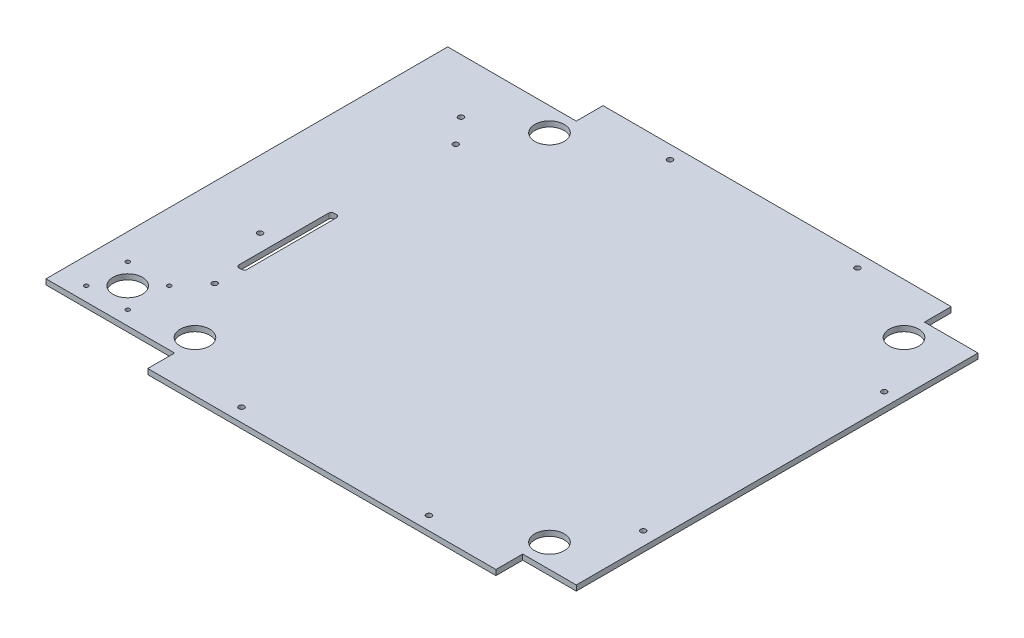
from build123d import *

# Parameters (mm, degrees)
SKETCH1_4_R         = 11
SKETCH1_4_R_2       = 2
SKETCH1_4_R_3       = 1.5
BOSS_EXTRUDE3_DEPTH = 4


with BuildPart() as part:
    # Sketch1<4> → Boss-Extrude3 (new body)
    with BuildSketch(Plane(origin=(0, 0, 0), x_dir=(1, 0, 0), z_dir=(0, 1, 0))):
        Polygon((130, -150), (170, -150), (170, 150), (130, 150), (130, 170), (-130, 170), (-130, 150), (-226, 150), (-226, -150), (-130, -150), (-130, -170), (130, -170), align=None)
        with Locations((132.375, -132.375)):
            Circle(SKETCH1_4_R, mode=Mode.SUBTRACT)
        with Locations((160, -90)):
            Circle(SKETCH1_4_R_2, mode=Mode.SUBTRACT)
        with Locations((160, 90)):
            Circle(SKETCH1_4_R_2, mode=Mode.SUBTRACT)
        with Locations((132.375, 132.375)):
            Circle(SKETCH1_4_R, mode=Mode.SUBTRACT)
        with Locations((70, -160)):
            Circle(SKETCH1_4_R_2, mode=Mode.SUBTRACT)
        with Locations((-70, -160)):
            Circle(SKETCH1_4_R_2, mode=Mode.SUBTRACT)
        with BuildLine():
            ThreePointArc((-163, -2), (-162.414213562, -0.585786438), (-161, 0))
            Line((-161, 0), (-159, 0))
            ThreePointArc((-159, 0), (-157.585786438, -0.585786438), (-157, -2))
            Line((-157, -2), (-157, -68.911348687))
            ThreePointArc((-157, -68.911348687), (-157.585786438, -70.325562249), (-159, -70.911348687))
            Line((-159, -70.911348687), (-161, -70.911348687))
            ThreePointArc((-161, -70.911348687), (-162.414213562, -70.325562249), (-163, -68.911348687))
            Line((-163, -68.911348687), (-163, -2))
        make_face(mode=Mode.SUBTRACT)
        with Locations((-160, 90)):
            Circle(SKETCH1_4_R_2, mode=Mode.SUBTRACT)
        with Locations((-132.375, 132.375)):
            Circle(SKETCH1_4_R, mode=Mode.SUBTRACT)
        with Locations((-132.375, -132.375)):
            Circle(SKETCH1_4_R, mode=Mode.SUBTRACT)
        with Locations((-160, -90)):
            Circle(SKETCH1_4_R_2, mode=Mode.SUBTRACT)
        with Locations((70, 160)):
            Circle(SKETCH1_4_R_2, mode=Mode.SUBTRACT)
        with Locations((-70, 160)):
            Circle(SKETCH1_4_R_2, mode=Mode.SUBTRACT)
        with Locations((-175.5, -108.5)):
            Circle(SKETCH1_4_R_3, mode=Mode.SUBTRACT)
        with Locations((-206.5, -139.5)):
            Circle(SKETCH1_4_R_3, mode=Mode.SUBTRACT)
        with Locations((-175.5, -139.5)):
            Circle(SKETCH1_4_R_3, mode=Mode.SUBTRACT)
        with Locations((-206.5, -108.5)):
            Circle(SKETCH1_4_R_3, mode=Mode.SUBTRACT)
        with Locations((-191, -124)):
            Circle(SKETCH1_4_R, mode=Mode.SUBTRACT)
        with Locations((-175.6, -40.5)):
            Circle(SKETCH1_4_R_2, mode=Mode.SUBTRACT)
        with Locations((-175.6, 109.5)):
            Circle(SKETCH1_4_R_2, mode=Mode.SUBTRACT)
    extrude(amount=BOSS_EXTRUDE3_DEPTH)


solid = part.part
